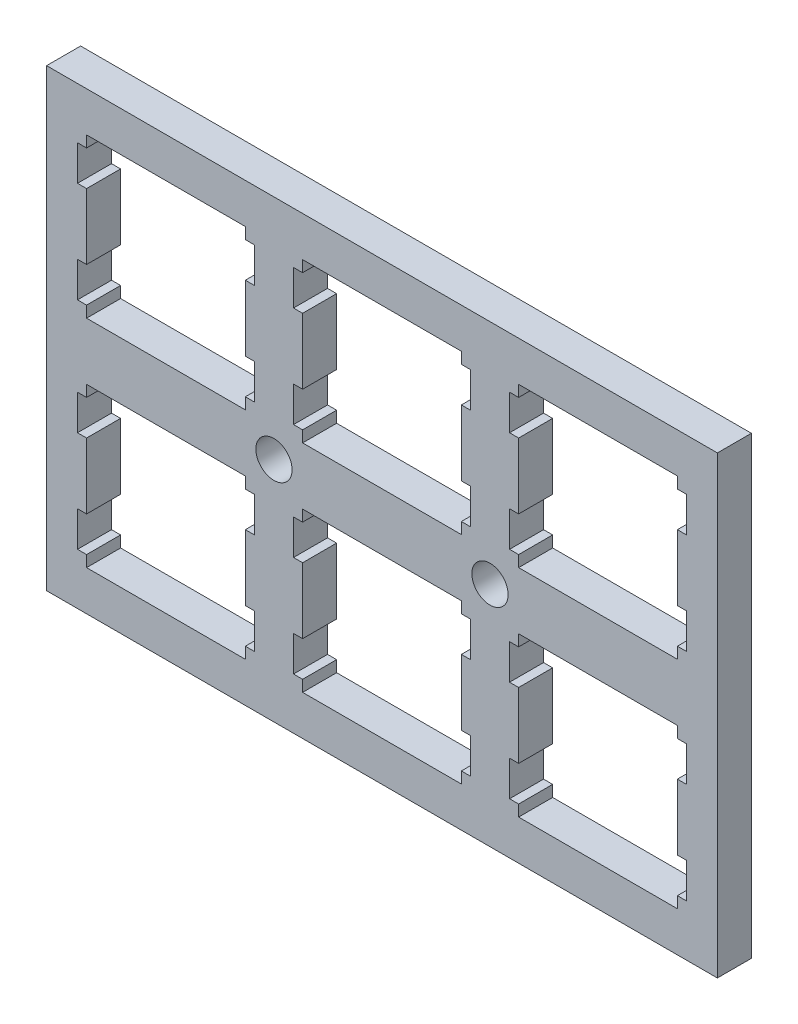
from build123d import *

# Parameters (mm, degrees)
MODEL_W         = 59.1502154
MODEL_H         = 40.099807
MODEL_R         = 1.6
EXTRUDE_1_DEPTH = 3


with BuildPart() as part:
    # Model → 凸台-拉伸1 (new body)
    with BuildSketch(Plane.XY):
        with Locations((28.6701923, 19.3075965)):
            Rectangle(MODEL_W, MODEL_H)
        with Locations((19.14445, 19.3077)):
            Circle(MODEL_R, mode=Mode.SUBTRACT)
        with Locations((38.19435, 19.3077)):
            Circle(MODEL_R, mode=Mode.SUBTRACT)
        Polygon((40.7197, 16.7831), (40.7197, 15.7827), (39.9189, 15.7827), (39.9189, 12.6835), (40.7197, 12.6835), (40.7197, 6.88329), (39.9189, 6.88329), (39.9189, 3.78273), (40.7197, 3.78273), (40.7197, 2.78364), (54.719, 2.78364), (54.719, 3.78273), (55.5198, 3.78273), (55.5198, 6.88329), (54.719, 6.88329), (54.719, 12.6835), (55.5198, 12.6835), (55.5198, 15.7827), (54.719, 15.7827), (54.719, 16.7831), align=None, mode=Mode.SUBTRACT)
        Polygon((21.6697, 16.7831), (21.6697, 15.7827), (20.869, 15.7827), (20.869, 12.6835), (21.6697, 12.6835), (21.6697, 6.88329), (20.869, 6.88329), (20.869, 3.78273), (21.6697, 3.78273), (21.6697, 2.78364), (35.669, 2.78364), (35.669, 3.78273), (36.4698, 3.78273), (36.4698, 6.88329), (35.669, 6.88329), (35.669, 12.6835), (36.4698, 12.6835), (36.4698, 15.7827), (35.669, 15.7827), (35.669, 16.7831), align=None, mode=Mode.SUBTRACT)
        Polygon((2.61965, 16.7831), (2.61965, 15.7827), (1.81901, 15.7827), (1.81901, 12.6835), (2.61965, 12.6835), (2.61965, 6.88329), (1.81901, 6.88329), (1.81901, 3.78273), (2.61965, 3.78273), (2.61965, 2.78364), (16.6192, 2.78364), (16.6192, 3.78273), (17.4198, 3.78273), (17.4198, 6.88329), (16.6192, 6.88329), (16.6192, 12.6835), (17.4198, 12.6835), (17.4198, 15.7827), (16.6192, 15.7827), (16.6192, 16.7831), align=None, mode=Mode.SUBTRACT)
        Polygon((40.7197, 35.833), (40.7197, 34.8327), (39.9189, 34.8327), (39.9189, 31.7335), (40.7197, 31.7335), (40.7197, 25.9333), (39.9189, 25.9333), (39.9189, 22.8327), (40.7197, 22.8327), (40.7197, 21.8336), (54.719, 21.8336), (54.719, 22.8327), (55.5198, 22.8327), (55.5198, 25.9333), (54.719, 25.9333), (54.719, 31.7335), (55.5198, 31.7335), (55.5198, 34.8327), (54.719, 34.8327), (54.719, 35.833), align=None, mode=Mode.SUBTRACT)
        Polygon((21.6697, 35.833), (21.6697, 34.8327), (20.869, 34.8327), (20.869, 31.7335), (21.6697, 31.7335), (21.6697, 25.9333), (20.869, 25.9333), (20.869, 22.8327), (21.6697, 22.8327), (21.6697, 21.8336), (35.669, 21.8336), (35.669, 22.8327), (36.4698, 22.8327), (36.4698, 25.9333), (35.669, 25.9333), (35.669, 31.7335), (36.4698, 31.7335), (36.4698, 34.8327), (35.669, 34.8327), (35.669, 35.833), align=None, mode=Mode.SUBTRACT)
        Polygon((2.61965, 35.833), (2.61965, 34.8327), (1.81901, 34.8327), (1.81901, 31.7335), (2.61965, 31.7335), (2.61965, 25.9333), (1.81901, 25.9333), (1.81901, 22.8327), (2.61965, 22.8327), (2.61965, 21.8336), (16.6192, 21.8336), (16.6192, 22.8327), (17.4198, 22.8327), (17.4198, 25.9333), (16.6192, 25.9333), (16.6192, 31.7335), (17.4198, 31.7335), (17.4198, 34.8327), (16.6192, 34.8327), (16.6192, 35.833), align=None, mode=Mode.SUBTRACT)
    extrude(amount=EXTRUDE_1_DEPTH)


solid = part.part
